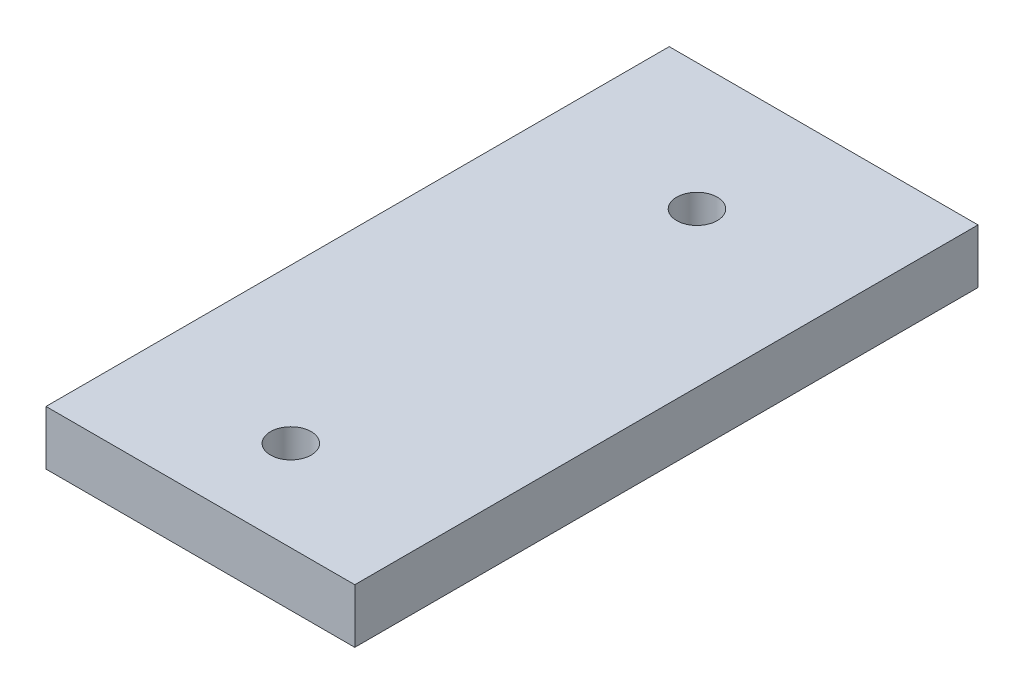
from build123d import *

# Parameters (mm, degrees)
SKETCH1_W           = 34.135361425
SKETCH1_H           = 68.896006058
BOSS_EXTRUDE1_DEPTH = 6
CUT_EXTRUDE1_REACH  = 47.732
SKETCH2_R           = 2.25


with BuildPart() as part:
    # Sketch1 → Boss-Extrude1 (new body)
    with BuildSketch(Plane(origin=(0, 0, 0), x_dir=(1, 0, 0), z_dir=(0, 1, 0))):
        with Locations((2.281890395, 6.551561836)):
            Rectangle(SKETCH1_W, SKETCH1_H)
    extrude(amount=BOSS_EXTRUDE1_DEPTH)

    # Sketch2 → Cut-Extrude1 (cut, up to next)
    with BuildSketch(Plane(origin=(0, 6, 0), x_dir=(1, 0, 0), z_dir=(0, 1, 0)), mode=Mode.PRIVATE) as cut_extrude1_sk1:
        with Locations((2.281890395, -17.896441193)):
            Circle(SKETCH2_R)
    cut_extrude1_tool1 = extrude(cut_extrude1_sk1.sketch, amount=-CUT_EXTRUDE1_REACH, mode=Mode.PRIVATE) & part.part
    # Sketch2 → Cut-Extrude1 (cut, up to next)
    with BuildSketch(Plane(origin=(0, 6, 0), x_dir=(1, 0, 0), z_dir=(0, 1, 0)), mode=Mode.PRIVATE) as cut_extrude1_sk2:
        with Locations((2.281890395, 26.999564865)):
            Circle(SKETCH2_R)
    cut_extrude1_tool2 = extrude(cut_extrude1_sk2.sketch, amount=-CUT_EXTRUDE1_REACH, mode=Mode.PRIVATE) & part.part
    add(cut_extrude1_tool1.solids().sort_by_distance((2.28189, 6, 17.896441))[0], mode=Mode.SUBTRACT)
    add(cut_extrude1_tool2.solids().sort_by_distance((2.28189, 6, -26.999565))[0], mode=Mode.SUBTRACT)


solid = part.part
